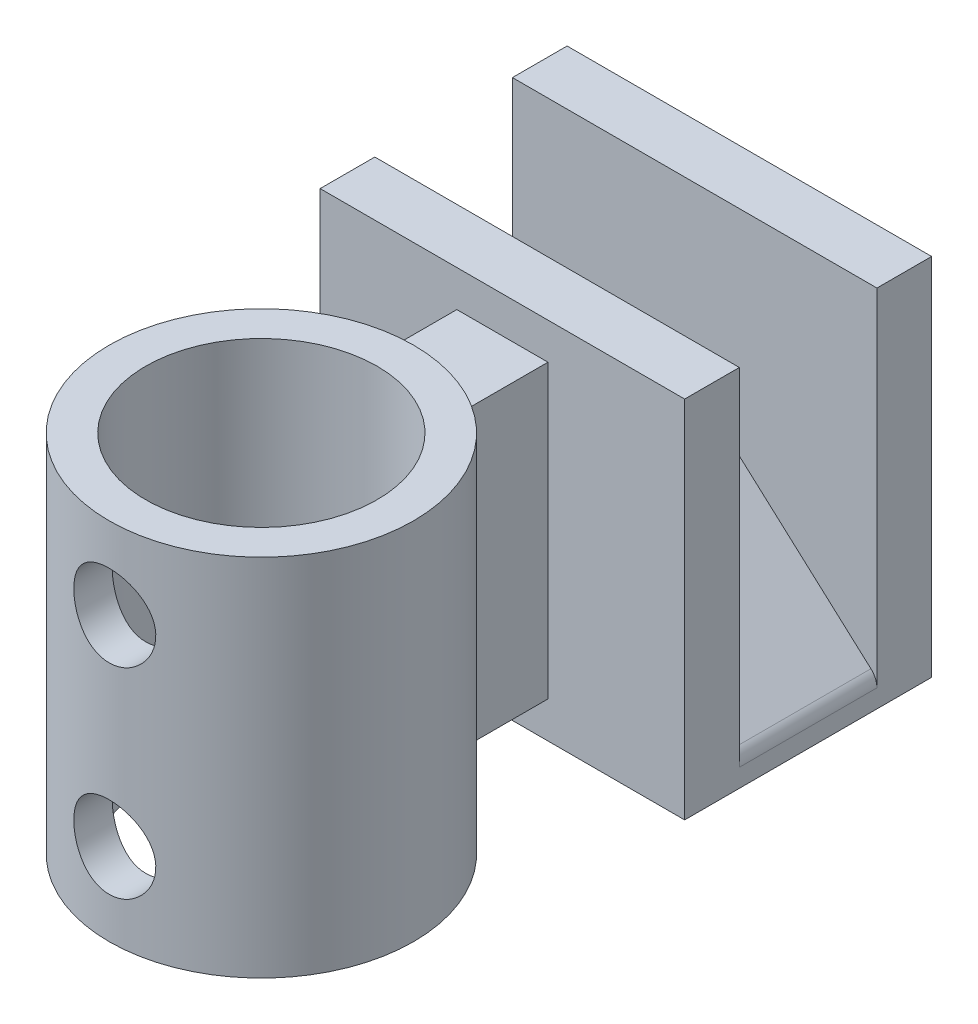
from build123d import *

# Parameters (mm, degrees)
SKETCH2_W                       = 20
SKETCH2_H                       = 10
BOSS_EXTRUDE1_DEPTH             = 3.775
CHAMFER1_SIZE                   = 9.5
CHAMFER1_SIZE2                  = 8.553838421
FILLET3_R                       = 1
SKETCH3_W                       = 20
SKETCH3_H                       = 20
BOSS_EXTRUDE2_DEPTH             = 3
BOSS_EXTRUDE3_REACH             = 21.259
SKETCH6_R                       = 8.35
SKETCH6_R_2                     = 6.35
BOSS_EXTRUDE3_DIRECTION_2_REACH = 21.259
BOSS_EXTRUDE4_REACH             = 30.115
BOSS_EXTRUDE4_END_RADIUS        = 8.35
SKETCH5_W                       = 5
SKETCH5_H                       = 16
CUT_EXTRUDE1_REACH              = 34.278
CUT_EXTRUDE1_END_RADIUS         = 8.35
SKETCH7_R                       = 2.25


with BuildPart() as part:
    # Sketch2 → Boss-Extrude1 (new, symmetric)
    with BuildSketch(Plane.XY):
        Rectangle(SKETCH2_W, SKETCH2_H)
    extrude(amount=BOSS_EXTRUDE1_DEPTH, both=True)

    # Chamfer1
    chamfer1_edges = [part.edges().sort_by_distance(p)[0] for p in [
        (10, 5, 0),
        (-10, 5, 0),
    ]]
    chamfer1_side = [part.faces().sort_by_distance(p)[0] for p in [
        (0, 5, 0),
    ]]
    chamfer(chamfer1_edges, length=CHAMFER1_SIZE, length2=CHAMFER1_SIZE2, reference=chamfer1_side[0])

    # Fillet3
    fillet3_edges = [part.edges().sort_by_distance(p)[0] for p in [
        (-10, -3.553838421, 0),
        (10, -3.553838421, 0),
        (0.5, 5, 0),
        (-0.5, 5, 0),
    ]]
    fillet(fillet3_edges, radius=FILLET3_R)

    # Sketch3 → Boss-Extrude2 (add)
    with BuildSketch(Plane.XY.offset(3.775)):
        with Locations((0, 5)):
            Rectangle(SKETCH3_W, SKETCH3_H)
    boss_extrude2 = extrude(amount=BOSS_EXTRUDE2_DEPTH)

    # Mirror1: Boss-Extrude2 across plane
    add(boss_extrude2.mirror(Plane.XY))


with BuildPart() as body_2:

    # Boss-Extrude3: up to this face of the body (flat: up to its plane)
    boss_extrude3_end = Plane(part.part.faces().sort_by_distance((0, 15, 5.275))[0])
    # Sketch6 → Boss-Extrude3 (new, up to the picked face)
    with BuildSketch(Plane(origin=(0, 0, 0), x_dir=(1, 0, 0), z_dir=(0, 1, 0)), mode=Mode.PRIVATE) as boss_extrude3_sk1:
        with Locations((0, -20)):
            Circle(SKETCH6_R)
        with Locations((0, -20)):
            Circle(SKETCH6_R_2, mode=Mode.SUBTRACT)
    boss_extrude3_tool1 = split(extrude(boss_extrude3_sk1.sketch, amount=BOSS_EXTRUDE3_REACH, mode=Mode.PRIVATE), bisect_by=boss_extrude3_end, keep=Keep.BOTH, mode=Mode.PRIVATE)
    add(boss_extrude3_tool1.solids().sort_by(Axis((-8.113826, 0, 20), (0, 1, 0)))[0])


    # Boss-Extrude3 direction 2: up to this face of the body (flat: up to its plane)
    boss_extrude3_direction_2_end = Plane(part.part.faces().sort_by_distance((0, -5, 0))[0])
    # Sketch6 → Boss-Extrude3 direction 2 (add, up to the picked face)
    with BuildSketch(Plane(origin=(0, 0, 0), x_dir=(1, 0, 0), z_dir=(0, 1, 0)), mode=Mode.PRIVATE) as boss_extrude3_direction_2_sk1:
        with Locations((0, -20)):
            Circle(SKETCH6_R)
        with Locations((0, -20)):
            Circle(SKETCH6_R_2, mode=Mode.SUBTRACT)
    boss_extrude3_direction_2_tool1 = split(extrude(boss_extrude3_direction_2_sk1.sketch, amount=-BOSS_EXTRUDE3_DIRECTION_2_REACH, mode=Mode.PRIVATE), bisect_by=boss_extrude3_direction_2_end, keep=Keep.BOTH, mode=Mode.PRIVATE)
    add(boss_extrude3_direction_2_tool1.solids().sort_by(Axis((-8.113826, 0, 20), (0, -1, 0)))[0])


with BuildPart() as part_1:
    add(part.part)

    add(body_2.part)  # Boss-Extrude4 merges body 2
    # Boss-Extrude4: up to this cylinder (the profile starts outside it)
    boss_extrude4_end = Plane(origin=(0, 5, 20), z_dir=(0, -1, 0)) * Cylinder(BOSS_EXTRUDE4_END_RADIUS, 77.93, mode=Mode.PRIVATE)
    # Sketch5 → Boss-Extrude4 (add, up to the surface)
    with BuildSketch(Plane.XY.offset(6.775), mode=Mode.PRIVATE) as boss_extrude4_sk1:
        with Locations((0, 5)):
            Rectangle(SKETCH5_W, SKETCH5_H)
    boss_extrude4_tool1 = extrude(boss_extrude4_sk1.sketch, amount=BOSS_EXTRUDE4_REACH, mode=Mode.PRIVATE) - boss_extrude4_end
    add(boss_extrude4_tool1.solids().sort_by_distance((0, 5, 6.775))[0])

    # Cut-Extrude1: up to this cylinder (the profile starts inside it)
    cut_extrude1_end = Plane(origin=(0, 5, 20), z_dir=(0, -1, 0)) * Cylinder(CUT_EXTRUDE1_END_RADIUS, 97.256, mode=Mode.PRIVATE)
    # Sketch7 → Cut-Extrude1 (cut, up to the surface)
    with BuildSketch(Plane.XY.offset(20), mode=Mode.PRIVATE) as cut_extrude1_sk1:
        with Locations((0, 10.5)):
            Circle(SKETCH7_R)
    cut_extrude1_tool1 = extrude(cut_extrude1_sk1.sketch, amount=CUT_EXTRUDE1_REACH, mode=Mode.PRIVATE) & cut_extrude1_end
    add(cut_extrude1_tool1.solids().sort_by_distance((0, 10.5, 20))[0], mode=Mode.SUBTRACT)
    # Sketch7 → Cut-Extrude1 (cut, up to the surface)
    with BuildSketch(Plane.XY.offset(20), mode=Mode.PRIVATE) as cut_extrude1_sk2:
        with Locations((0, -0.5)):
            Circle(SKETCH7_R)
    cut_extrude1_tool2 = extrude(cut_extrude1_sk2.sketch, amount=CUT_EXTRUDE1_REACH, mode=Mode.PRIVATE) & cut_extrude1_end
    add(cut_extrude1_tool2.solids().sort_by_distance((0, -0.5, 20))[0], mode=Mode.SUBTRACT)


solid = part_1.part
